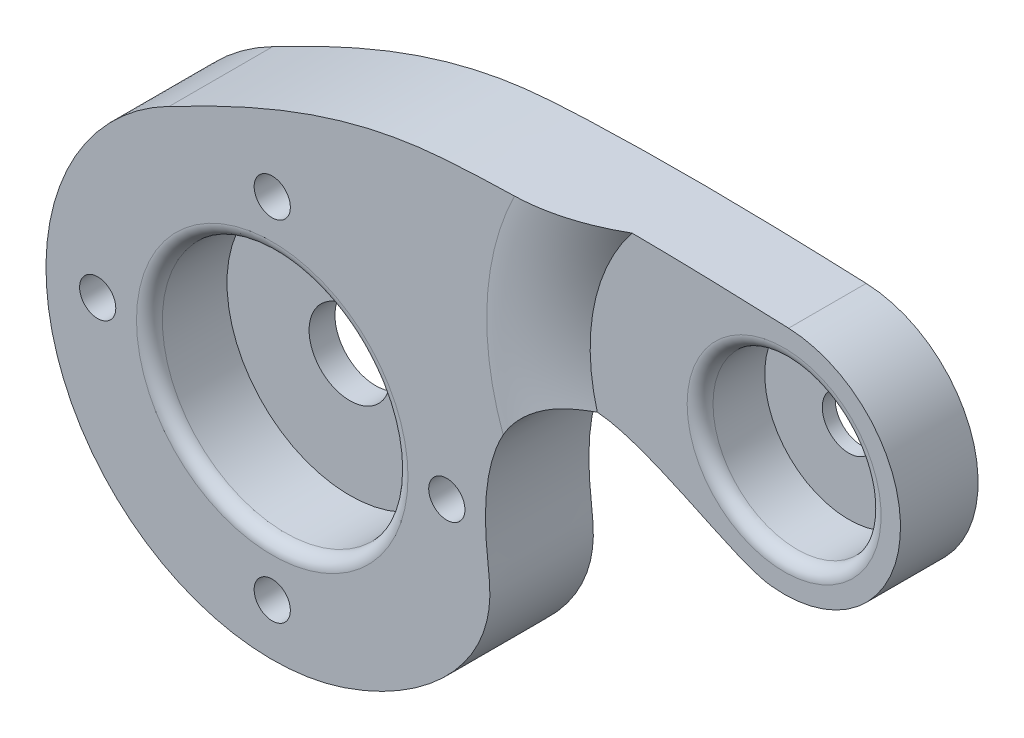
from build123d import *

# Parameters (mm, degrees)
SKETCH1_R           = 6.5
SKETCH1_R_2         = 9.5
SKETCH1_R_3         = 3.15
SKETCH1_R_4         = 2.05
BOSS_EXTRUDE1_DEPTH = 8
SKETCH2_R           = 1.4
CUT_EXTRUDE1_DEPTH  = 10
SKETCH3_R           = 9.5
CUT_EXTRUDE2_DEPTH  = 6
CUT_EXTRUDE3_START  = -2
CUT_EXTRUDE3_DEPTH  = 2
SKETCH6_R           = 6.5
CUT_EXTRUDE4_DEPTH  = 5
FILLET1_R           = 10
FILLET3_R           = 1
FILLET4_R           = 1


with BuildPart() as part:
    # Sketch1 → Boss-Extrude1 (new body)
    # profile 1 of 3: a face of its own
    with BuildSketch(Plane.XY):
        with BuildLine():
            ThreePointArc((-7.96176738, 15.583974467), (-16.133848008, -6.77856537), (5.557683878, -16.59403959))
            add(Edge.make_bspline(
                [(5.557683878, -16.59403959), (11.479074635, -14.610844493), (17.751405143, -9.234245164), (16.115757619, 0.631694436), (16.825810009, 7.052286054), (24.274178409, 11.505601391), (33.300706558, 5.113807946), (36.561337581, 4.739521135)],
                knots=[0, 0, 0, 0, 0.382951965, 0.45496999, 0.690712447, 0.748162229, 1, 1, 1, 1], degree=3))
            ThreePointArc((36.561337581, 4.739521135), (46.561462901, 12.994026209), (37.933909918, 22.674144492))
            add(Edge.make_bspline(
                [(-7.96176738, 15.583974467), (-3.039767553, 18.098597277), (5.12659712, 22.317732547), (23.583922654, 23.226880319), (32.652703513, 22.877448356), (37.933909918, 22.674144492)],
                knots=[0, 0, 0, 0, 0.429359774, 0.529359774, 1, 1, 1, 1], degree=3))
        make_face()
        with Locations((37.587704831, 13.680805733)):
            Circle(SKETCH1_R, mode=Mode.SUBTRACT)
        Circle(SKETCH1_R_2, mode=Mode.SUBTRACT)
    # profile 2 of 3: a face of its own
    with BuildSketch(Plane.XY):
        Circle(SKETCH1_R_2)
        Circle(SKETCH1_R_3, mode=Mode.SUBTRACT)
    # profile 3 of 3: a face of its own
    with BuildSketch(Plane.XY):
        with Locations((37.587704831, 13.680805733)):
            Circle(SKETCH1_R)
        with Locations((37.587704831, 13.680805733)):
            Circle(SKETCH1_R_4, mode=Mode.SUBTRACT)
    extrude(amount=BOSS_EXTRUDE1_DEPTH)

    # Sketch2 → Cut-Extrude1 (cut)
    with BuildSketch(Plane.XY.offset(8)):
        with Locations((0, 13.5)):
            Circle(SKETCH2_R)
        with Locations((13.5, 0)):
            Circle(SKETCH2_R)
        with Locations((0, -13.5)):
            Circle(SKETCH2_R)
        with Locations((-13.5, 0)):
            Circle(SKETCH2_R)
    extrude(amount=-CUT_EXTRUDE1_DEPTH, mode=Mode.SUBTRACT)

    # Sketch3 → Cut-Extrude2 (cut)
    with BuildSketch(Plane.XY.offset(8)):
        Circle(SKETCH3_R)
    extrude(amount=-CUT_EXTRUDE2_DEPTH, mode=Mode.SUBTRACT)

    # Sketch5 → Cut-Extrude3 (cut)
    with BuildSketch(Plane.XY.offset(8).offset(CUT_EXTRUDE3_START)):
        with BuildLine():
            ThreePointArc((25.825503891, 22.989437697), (22.883298202, 16.643984039), (23.138245926, 9.654251705))
            add(Edge.make_bspline(
                [(23.138245926, 9.654251705), (27.396044405, 9.314768535), (33.630557167, 5.075944498), (36.561337581, 4.739521135)],
                knots=[0.773638537, 0.773638537, 0.773638537, 0.773638537, 1, 1, 1, 1], degree=3))
            ThreePointArc((36.561337581, 4.739521135), (46.561462901, 12.994026209), (37.933909918, 22.674144492))
            add(Edge.make_bspline(
                [(37.933909918, 22.674144492), (34.650963076, 22.800523908), (30.51852808, 22.959707824), (25.825503891, 22.989437697)],
                knots=[0, 0, 0, 0, 0.292563237, 0.292563237, 0.292563237, 0.292563237], degree=3))
        make_face()
    extrude(amount=CUT_EXTRUDE3_DEPTH, mode=Mode.SUBTRACT)

    # Sketch6 → Cut-Extrude4 (cut)
    with BuildSketch(Plane.XY.offset(6)):
        with Locations((37.587704831, 13.680805733)):
            Circle(SKETCH6_R)
    extrude(amount=-CUT_EXTRUDE4_DEPTH, mode=Mode.SUBTRACT)

    # Fillet1
    # the kernel refuses this fillet: 10 mm, written as the material it takes off along each edge
    with BuildSketch(Plane(origin=(37.587704831, 13.680805733, 8), x_dir=(0.09866346978303978, 0.9951208568462281, 0), z_dir=(0.9951208568462281, -0.09866346978303978, 0))) as fillet1_piece_1:
        with BuildLine():
            CenterArc((21, -10), FILLET1_R, 90, 36.869897646)
            Line((21, 0), (21, 0.2))
            Line((21, 0.2), (15, 0.2))
            Line((15, 0.2), (14.8, 0))
            ThreePointArc((14.8, 0), (14.8, -1), (14.88, -1.84))
            Line((14.88, -1.84), (15, -2))
        make_face()
    revolve(axis=Axis((37.587704831, 13.680805733, 8), (0, 0, 1)), revolution_arc=168.537531078, mode=Mode.SUBTRACT)

    # Fillet3
    fillet3_edges = [part.edges().sort_by_distance(p)[0] for p in [
        (31.087704831, 13.680805733, 6),
    ]]
    fillet(fillet3_edges, radius=FILLET3_R)

    # Fillet4
    fillet4_edges = [part.edges().sort_by_distance(p)[0] for p in [
        (-9.5, 0, 8),
    ]]
    fillet(fillet4_edges, radius=FILLET4_R)


solid = part.part
